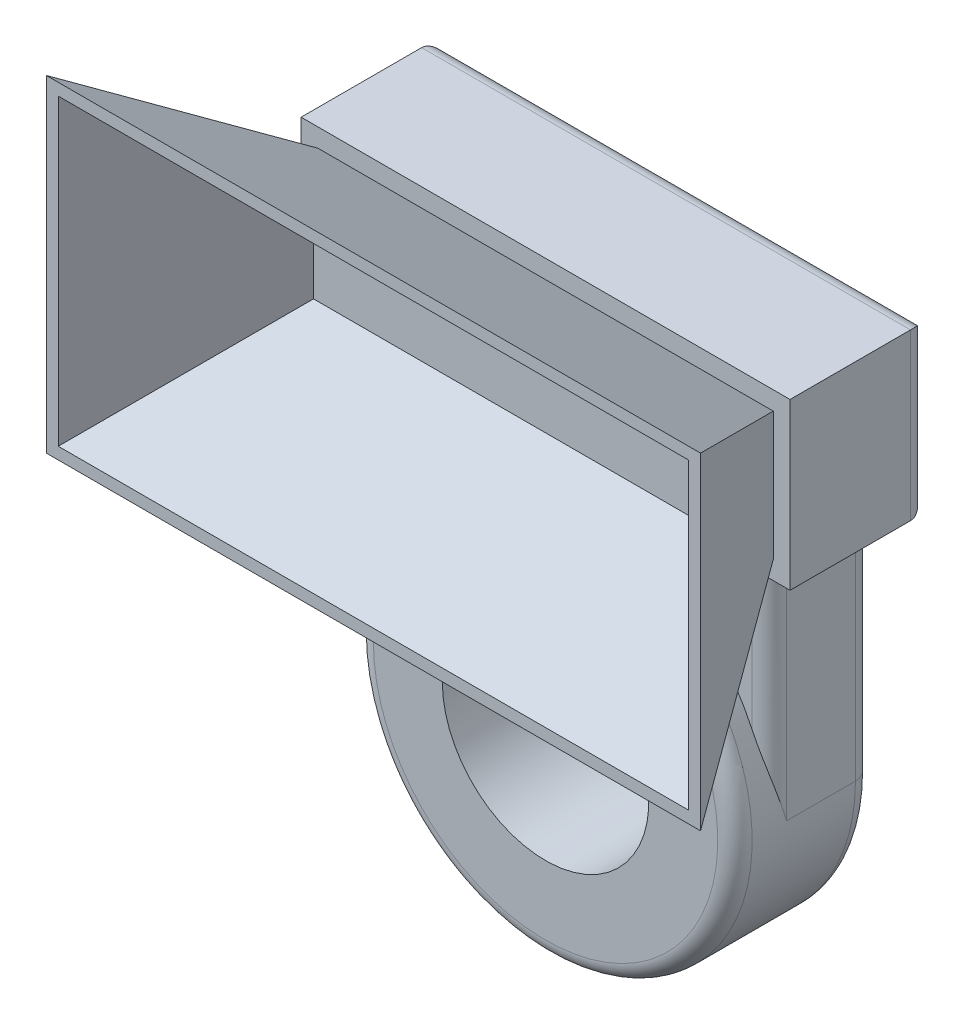
from build123d import *

# Parameters (mm, degrees)
LIGHT_PROFILE_W               = 190
LIGHT_PROFILE_H               = 95
LIGHT_EXTRUDE_DEPTH           = 50
LIGHT_EXTRUDE_DRAFT           = -30
LIGHT_SHELL_T                 = -3
ELECTRONICS_BOX_SKETCH_W      = 142
ELECTRONICS_BOX_SKETCH_H      = 48
ELECTRONICS_BOX_EXTRUDE_DEPTH = 40
SUPPORT_EXTRUDE_DEPTH         = 40
BACK_FILLET_R                 = 5
WRIST_HOLE_SKETCH_R           = 30
WRIST_HOLE_CUT_DEPTH          = 40
SUPPORT_INSET_CUT_DEPTH       = 10
FRONT_FILLET_R                = 5


with BuildPart() as part:
    # Light Profile → Light Extrude (with draft: the straight prism first)
    with BuildSketch(Plane.XY):
        Rectangle(LIGHT_PROFILE_W, LIGHT_PROFILE_H)
    extrude(amount=-LIGHT_EXTRUDE_DEPTH)
    # Light Extrude: the draft: its side faces are tilted about the plane it starts from
    light_extrude_sides = [part.faces().sort_by_distance(p)[0] for p in [
        (-95, 0, -25),
        (0, -47.5, -25),
        (95, 0, -25),
        (0, 47.5, -25),
    ]]
    draft(light_extrude_sides, Plane.XY, LIGHT_EXTRUDE_DRAFT)

    # Light Shell
    light_shell_openings = [part.faces().sort_by_distance(p)[0] for p in [
        (0, 0, 0),
    ]]
    offset(amount=LIGHT_SHELL_T, openings=light_shell_openings, kind=Kind.INTERSECTION)

    # Electronics Box Sketch → Electronics Box Extrude (add)
    with BuildSketch(Plane(origin=(0, 0, -50), x_dir=(-1, 0, 0), z_dir=(0, 0, -1))):
        Rectangle(ELECTRONICS_BOX_SKETCH_W, ELECTRONICS_BOX_SKETCH_H)
    extrude(amount=ELECTRONICS_BOX_EXTRUDE_DEPTH)

    # Support Sketch → Support Extrude (add)
    with BuildSketch(Plane.XY.offset(-50)):
        with BuildLine():
            Line((55, -97.5), (55, -24))
            Line((55, -24), (-55, -24))
            Line((-55, -24), (-55, -97.5))
            ThreePointArc((-55, -97.5), (0, -152.5), (55, -97.5))
        make_face()
    extrude(amount=-SUPPORT_EXTRUDE_DEPTH)

    # Back Fillet
    back_fillet_edges = [part.edges().sort_by_distance(p)[0] for p in [
        (-71, 0, -90),
        (0, 24, -90),
        (71, 0, -90),
        (63, -24, -90),
        (-63, -24, -90),
        (55, -60.75, -90),
        (-55, -60.75, -90),
        (0, -152.5, -90),
    ]]
    fillet(back_fillet_edges, radius=BACK_FILLET_R)

    # Wrist Hole Sketch → Wrist Hole Cut (cut)
    with BuildSketch(Plane(origin=(0, 0, -90), x_dir=(-1, 0, 0), z_dir=(0, 0, -1))):
        with Locations((0, -97.5)):
            Circle(WRIST_HOLE_SKETCH_R)
    extrude(amount=-WRIST_HOLE_CUT_DEPTH, mode=Mode.SUBTRACT)

    # Support Inset Sketch → Support Inset Cut (cut)
    with BuildSketch(Plane.XY.offset(-50)):
        with BuildLine():
            Line((-55, -24), (55, -24))
            Line((55, -24), (55, -42.5))
            Line((55, -42.5), (55, -97.5))
            ThreePointArc((55, -97.5), (0, -42.5), (-55, -97.5))
            Line((-55, -97.5), (-55, -42.5))
            Line((-55, -42.5), (-55, -24))
        make_face()
    extrude(amount=-SUPPORT_INSET_CUT_DEPTH, mode=Mode.SUBTRACT)

    # Front Fillet
    # the kernel refuses this fillet: 5 mm, written as the material it takes off along each edge
    with BuildSketch(Plane(origin=(0, -97.5, -50), x_dir=(-1, 0, 0), z_dir=(0, -1, 0))) as front_fillet_piece_1:
        with BuildLine():
            CenterArc((55 - FRONT_FILLET_R, FRONT_FILLET_R), FRONT_FILLET_R, 270, 90)
            Line((55, FRONT_FILLET_R), (55, 0))
            Line((55, 0), (55 - FRONT_FILLET_R, 0))
        make_face()
    revolve(axis=Axis((0, -97.5, -50), (0, 0, -1)), mode=Mode.SUBTRACT)
    with BuildSketch(Plane(origin=(-55, -24, -60), x_dir=(1, 0, 0), z_dir=(0, -1, 0))) as front_fillet_piece_2_section:
        with BuildLine():
            CenterArc((FRONT_FILLET_R, -FRONT_FILLET_R), FRONT_FILLET_R, 90, 90)
            Line((0, -FRONT_FILLET_R), (0, 0))
            Line((0, 0), (FRONT_FILLET_R, 0))
        make_face()
    front_fillet_piece_2 = extrude(amount=86, mode=Mode.PRIVATE)
    front_fillet_piece_2 = front_fillet_piece_2 - Plane(origin=(0, -97.5, -61.160200813), x_dir=(-1, 0, 0), z_dir=(0, 0, 1)) * Cylinder(55, 192, mode=Mode.PRIVATE)
    add(front_fillet_piece_2, mode=Mode.SUBTRACT)
    with BuildSketch(Plane(origin=(55, -110, -60), x_dir=(0, 0, -1), z_dir=(0, 1, 0))) as front_fillet_piece_3_section:
        with BuildLine():
            CenterArc((FRONT_FILLET_R, FRONT_FILLET_R), FRONT_FILLET_R, 180, 90)
            Line((0, FRONT_FILLET_R), (0, 0))
            Line((0, 0), (FRONT_FILLET_R, 0))
        make_face()
    front_fillet_piece_3 = extrude(amount=86, mode=Mode.PRIVATE)
    front_fillet_piece_3 = front_fillet_piece_3 - Plane(origin=(0, -97.5, -61.160225753), x_dir=(-1, 0, 0), z_dir=(0, 0, 1)) * Cylinder(55, 192, mode=Mode.PRIVATE)
    add(front_fillet_piece_3, mode=Mode.SUBTRACT)


solid = part.part
